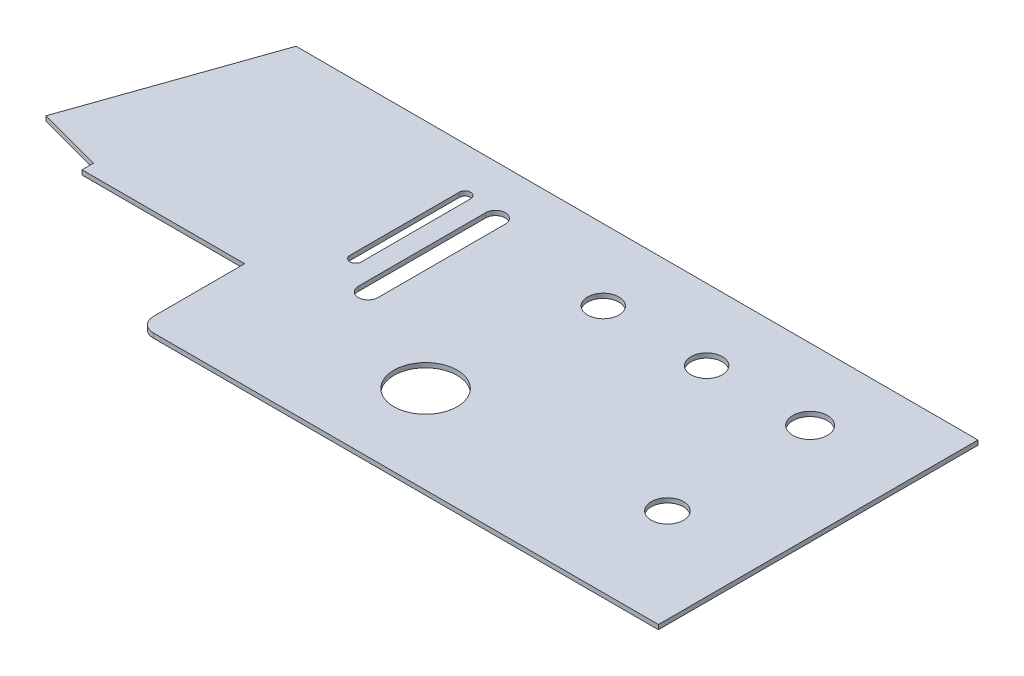
from build123d import *

# Parameters (mm, degrees)
SKETCH2_R           = 5.5
SKETCH2_R_2         = 6.05
SKETCH2_R_3         = 11.1
SKETCH2_R_4         = 5.65
BOSS_EXTRUDE1_DEPTH = 1.6


with BuildPart() as part:
    # Sketch2 → Boss-Extrude1 (new body)
    with BuildSketch(Plane(origin=(0, 0, 0), x_dir=(1, 0, 0), z_dir=(0, 1, 0))):
        with BuildLine():
            Line((-101.372215876, 58.484499248), (137.627784124, 58.484499248))
            Line((137.627784124, 58.484499248), (137.627784124, -53.515500752))
            Line((137.627784124, -53.515500752), (-39.372215876, -53.515500752))
            ThreePointArc((-39.372215876, -53.515500752), (-42.907749781, -52.051034657), (-44.372215876, -48.515500752))
            Line((-44.372215876, -48.515500752), (-44.372215876, -16.515500752))
            Line((-44.372215876, -16.515500752), (-44.872215876, -16.515500752))
            Line((-44.872215876, -16.515500752), (-101.372215876, -16.515500752))
            Line((-101.372215876, -16.515500752), (-101.372215876, -12.515500752))
            Line((-101.372215876, -12.515500752), (-124.071472793, -6.433253192))
            Line((-124.071472793, -6.433253192), (-101.372215876, 58.484499248))
        make_face()
        with Locations((31.285988016, 33.484499248)):
            Circle(SKETCH2_R, mode=Mode.SUBTRACT)
        with Locations((67.535988016, 33.484499248)):
            Circle(SKETCH2_R, mode=Mode.SUBTRACT)
        with Locations((103.785988016, 33.484499248)):
            Circle(SKETCH2_R_2, mode=Mode.SUBTRACT)
        with Locations((25.177784124, -22.665500752)):
            Circle(SKETCH2_R_3, mode=Mode.SUBTRACT)
        with Locations((104.727784124, -17.465500752)):
            Circle(SKETCH2_R_4, mode=Mode.SUBTRACT)
        with BuildLine():
            Line((-28.472215876, 4.484499248), (-28.472215876, 42.784499248))
            ThreePointArc((-28.472215876, 42.784499248), (-26.472215876, 44.784499248), (-24.472215876, 42.784499248))
            Line((-24.472215876, 42.784499248), (-24.472215876, 4.484499248))
            ThreePointArc((-24.472215876, 4.484499248), (-26.472215876, 2.484499248), (-28.472215876, 4.484499248))
        make_face(mode=Mode.SUBTRACT)
        with BuildLine():
            Line((-10.722215876, 41.184499248), (-10.722215876, -3.415500752))
            ThreePointArc((-10.722215876, -3.415500752), (-14.172215876, -6.865500752), (-17.622215876, -3.415500752))
            Line((-17.622215876, -3.415500752), (-17.622215876, 41.184499248))
            ThreePointArc((-17.622215876, 41.184499248), (-14.172215876, 44.634499248), (-10.722215876, 41.184499248))
        make_face(mode=Mode.SUBTRACT)
    extrude(amount=BOSS_EXTRUDE1_DEPTH)


solid = part.part
